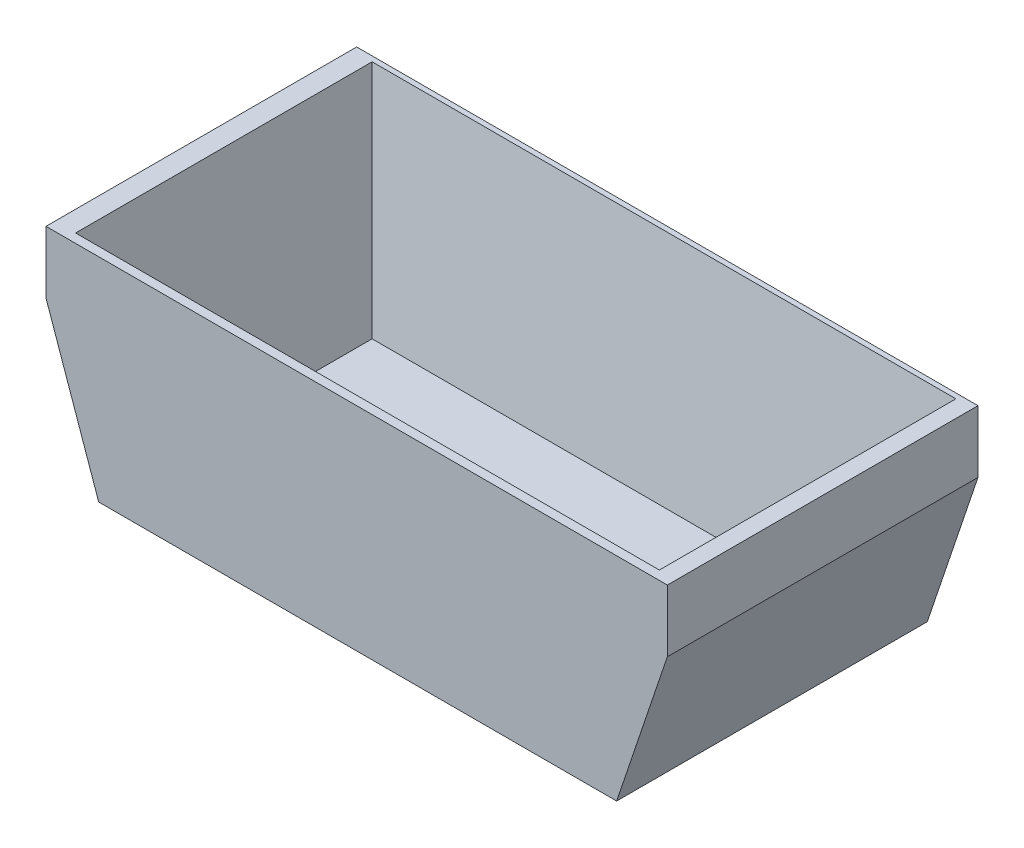
from build123d import *

# Parameters (mm, degrees)
BOSS_EXTRUDE1_DEPTH = 15
SKETCH4_W           = 28.186207002
SKETCH4_H           = 14.317152765
CUT_EXTRUDE2_DEPTH  = 10
CUT_EXTRUDE2_DRAFT  = -9
SCALE4_SCALE        = 10


with BuildPart() as part:
    # Sketch1 → Boss-Extrude1 (new body)
    with BuildSketch(Plane.XY):
        Polygon((-49.791399094, 32.645333647), (-19.791399094, 32.645333647), (-19.791399094, 29.645333647), (-22.238991949, 22.388566018), (-47.247714564, 22.388566018), (-49.791399094, 29.645333647), align=None)
    extrude(amount=BOSS_EXTRUDE1_DEPTH)


with BuildPart() as cut_extrude2_tool:
    # Sketch4 → Cut-Extrude2 (with draft: the straight prism first)
    with BuildSketch(Plane(origin=(0, 32.645333647, 0), x_dir=(1, 0, 0), z_dir=(0, 1, 0))):
        with Locations((-34.704376823, -7.406595874)):
            Rectangle(SKETCH4_W, SKETCH4_H)
    extrude(amount=-CUT_EXTRUDE2_DEPTH)
    # Cut-Extrude2: the draft: its side faces are tilted about the plane it starts from
    cut_extrude2_sides = [cut_extrude2_tool.faces().sort_by_distance(p)[0] for p in [
        (-48.797480324, 27.645333647, 7.406595874),
        (-34.704376823, 27.645333647, 14.565172256),
        (-20.611273322, 27.645333647, 7.406595874),
        (-34.704376823, 27.645333647, 0.248019491),
    ]]
    draft(cut_extrude2_sides, Plane(origin=(0, 32.645333647, 0), x_dir=(1, 0, 0), z_dir=(0, 1, 0)), CUT_EXTRUDE2_DRAFT)


with BuildPart() as part_1:
    add(part.part)

    # Cut-Extrude2: cut by cut_extrude2_tool
    add(cut_extrude2_tool.part, mode=Mode.SUBTRACT)


with BuildPart() as part_2:
    # Scale4: scaled about (-35.029496824, 26.738312596, 7.834512766)
    add(part_1.part.scale(SCALE4_SCALE).moved(Location((315.265471416, -240.644813364, -70.510614894))))


solid = part_2.part
